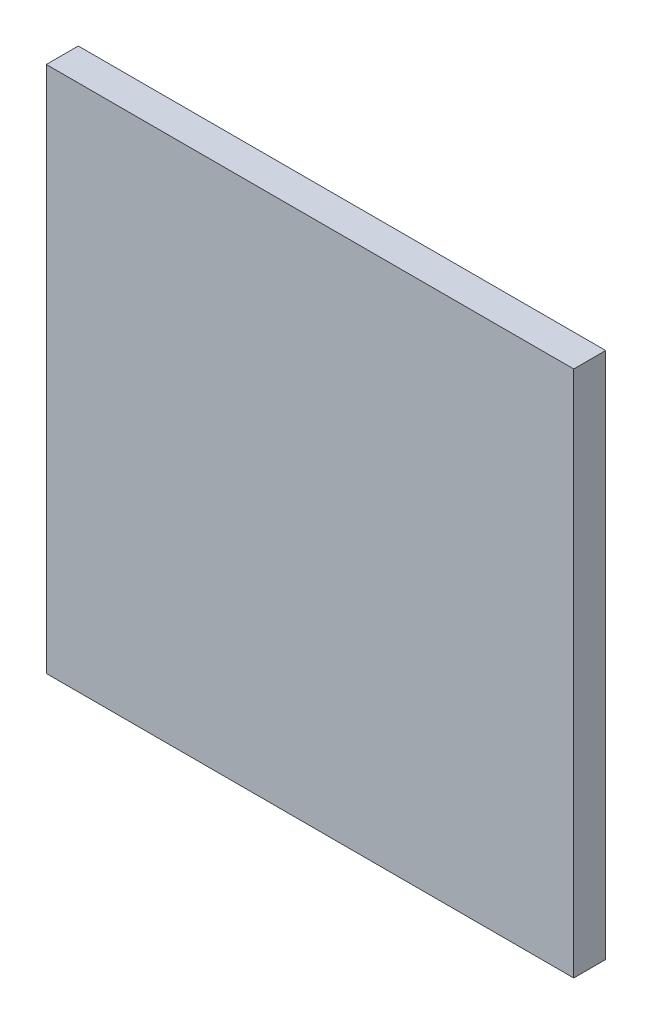
from build123d import *

# Parameters (mm, degrees)
SKETCH1_W           = 12.573
SKETCH1_H           = 12.573
BOSS_EXTRUDE1_DEPTH = 0.762
WRAP1_START         = -0.0508
WRAP1_DEPTH         = 0.0508


# Read off the part's stored shape, not the designer's step: Wrap1
with BuildPart() as part:
    # Sketch1 → Boss-Extrude1 (new body)
    with BuildSketch(Plane.XY):
        with Locations((-12.7, -106.3625)):
            Rectangle(SKETCH1_W, SKETCH1_H)
    extrude(amount=BOSS_EXTRUDE1_DEPTH)

    # Wrap1 outline → Wrap1 (cut)
    # profile 1 of 2: a face of its own
    with BuildSketch(Plane(origin=(0, 0, 0), x_dir=(-1, 0, 0), z_dir=(0, 0, -1)).offset(WRAP1_START)):
        with BuildLine():
            Line((13.893576609, -109.076767293), (13.848224931, -109.087871077))
            add(Edge.make_bspline(
                [(13.848224931, -109.087871077), (13.823281991, -109.09540343), (13.773440418, -109.110454755), (13.70247959, -109.142255202), (13.63418203, -109.178808447), (13.571127797, -109.224257623), (13.509613485, -109.27407518), (13.452633122, -109.331739179), (13.398630626, -109.395561914), (13.349044924, -109.465693939), (13.304301325, -109.541181248), (13.263834186, -109.619593938), (13.229962577, -109.701764726), (13.202140797, -109.787168697), (13.180033856, -109.876080706), (13.163381471, -109.968194926), (13.15384465, -110.063754119), (13.151261206, -110.128511062), (13.149950221, -110.161372385)],
                knots=[0, 0, 0, 0, 0.056876983, 0.113652934, 0.169591192, 0.22583551, 0.283188072, 0.342390943, 0.402653605, 0.465709187, 0.529811079, 0.594269064, 0.658351425, 0.723786874, 0.790362914, 0.858402864, 0.928145633, 1, 1, 1, 1], degree=3))
            add(Edge.make_bspline(
                [(13.149950221, -110.161372385), (13.151133652, -110.201387824), (13.153443848, -110.279502699), (13.169135154, -110.393288149), (13.190657418, -110.501386673), (13.221505103, -110.603374991), (13.258578554, -110.700191288), (13.306242747, -110.789812822), (13.360129711, -110.874231476), (13.422819758, -110.951148025), (13.491440908, -111.021209526), (13.566450448, -111.081782827), (13.645871161, -111.134442237), (13.730898183, -111.17697951), (13.82074451, -111.2111604), (13.916240063, -111.23441958), (14.016207988, -111.250588804), (14.084819235, -111.253546075), (14.119642212, -111.25504701)],
                knots=[0, 0, 0, 0, 0.07336391, 0.143215036, 0.210348057, 0.275297226, 0.338397068, 0.400134774, 0.461112918, 0.521784575, 0.581765109, 0.640634954, 0.698267936, 0.756179992, 0.81463112, 0.87415844, 0.936130329, 1, 1, 1, 1], degree=3))
            Line((14.119642212, -111.25504701), (14.86879804, -111.255046208))
            add(Edge.make_bspline(
                [(14.86879804, -111.255046208), (14.896966079, -111.253958886), (14.949201899, -111.251942518), (15.021159743, -111.237133618), (15.081127159, -111.214384084), (15.128076926, -111.179072565), (15.162401491, -111.132645731), (15.183093105, -111.074288901), (15.194773105, -111.005076775), (15.192949725, -110.955128247), (15.191968834, -110.928258345)],
                knots=[0, 0, 0, 0, 0.156430718, 0.290090734, 0.406759706, 0.509900415, 0.612128406, 0.722875106, 0.850920154, 1, 1, 1, 1], degree=3))
            Line((15.191968834, -110.928258345), (15.192294378, -107.807010932))
            add(Edge.make_bspline(
                [(15.192294378, -107.807010932), (15.192220374, -107.787963025), (15.192085749, -107.753311991), (15.191438705, -107.706340914), (15.189896895, -107.669622602), (15.187219904, -107.634430875), (15.177822601, -107.597311624), (15.161036391, -107.573746143), (15.152557136, -107.561842458)],
                knots=[0, 0, 0, 0, 0.225436693, 0.410103567, 0.55601467, 0.660125877, 0.828318623, 1, 1, 1, 1], degree=3))
            add(Edge.make_bspline(
                [(15.152557136, -107.561842458), (15.140824795, -107.549102492), (15.117230503, -107.523481817), (15.070603517, -107.49740351), (15.017309479, -107.481291692), (14.979436548, -107.47919208), (14.95960403, -107.478092599)],
                knots=[0, 0, 0, 0, 0.237755925, 0.478138407, 0.726722237, 1, 1, 1, 1], degree=3))
            add(Edge.make_bspline(
                [(14.95960403, -107.478092599), (14.940084055, -107.478357266), (14.903253541, -107.478856642), (14.85252232, -107.492093321), (14.810185229, -107.513828723), (14.776401924, -107.545676609), (14.752196068, -107.589176996), (14.736587199, -107.644114916), (14.726944693, -107.710663599), (14.726602158, -107.759136062), (14.726418149, -107.785175414)],
                knots=[0, 0, 0, 0, 0.130208102, 0.245678144, 0.347245765, 0.445678704, 0.551513815, 0.676036191, 0.825967013, 1, 1, 1, 1], degree=3))
            Line((14.726418149, -107.785175414), (14.726913682, -109.054559725))
            Line((14.726913682, -109.054559725), (14.415120899, -109.054559725))
            Line((14.415120899, -109.054559725), (13.576099632, -107.610337321))
            add(Edge.make_bspline(
                [(13.576099632, -107.610337321), (13.564208292, -107.591516547), (13.542627633, -107.557360201), (13.497448447, -107.518513669), (13.440591907, -107.499804868), (13.399966188, -107.498515186), (13.377388563, -107.497798448)],
                knots=[0, 0, 0, 0, 0.274636977, 0.498417098, 0.721246763, 1, 1, 1, 1], degree=3))
            add(Edge.make_bspline(
                [(13.377388563, -107.497798448), (13.360611811, -107.498540798), (13.32854378, -107.499959769), (13.282703643, -107.512137598), (13.241734712, -107.530784726), (13.205351857, -107.556424399), (13.176798041, -107.589734739), (13.15449874, -107.628489834), (13.141355897, -107.673794826), (13.139448942, -107.705993428), (13.138455142, -107.722773559)],
                knots=[0, 0, 0, 0, 0.136422267, 0.260765218, 0.38343879, 0.501594451, 0.620065055, 0.737841673, 0.86337758, 1, 1, 1, 1], degree=3))
            add(Edge.make_bspline(
                [(13.138455142, -107.722773559), (13.138374055, -107.735426661), (13.13822547, -107.75861247), (13.146111976, -107.787377308), (13.157344052, -107.810687106), (13.172271313, -107.833367722), (13.189422605, -107.864094381), (13.204212006, -107.885745963), (13.212352077, -107.89766297)],
                knots=[0, 0, 0, 0, 0.194991314, 0.357306156, 0.455808365, 0.594530958, 0.776830276, 1, 1, 1, 1], degree=3))
            Line((13.212352077, -107.89766297), (13.229901797, -107.925015099))
            Line((13.229901797, -107.925015099), (13.893576609, -109.076767293))
        make_face()
        with BuildLine():
            Line((14.726913682, -110.788673644), (14.103328117, -110.788673644))
            add(Edge.make_bspline(
                [(14.103328117, -110.788673644), (14.076993426, -110.78843001), (14.029903049, -110.787994357), (13.9651229, -110.77974118), (13.910491459, -110.761134075), (13.880319455, -110.740687073), (13.865108328, -110.730378777)],
                knots=[0, 0, 0, 0, 0.315692991, 0.564506423, 0.780447189, 1, 1, 1, 1], degree=3))
            add(Edge.make_bspline(
                [(13.865108328, -110.730378777), (13.846187402, -110.715953887), (13.807779881, -110.686672853), (13.760260425, -110.630238465), (13.716355076, -110.567373174), (13.68102564, -110.495143141), (13.652722065, -110.416560006), (13.630889006, -110.33340498), (13.618846348, -110.245741907), (13.616629954, -110.186038326), (13.615500906, -110.155624845)],
                knots=[0, 0, 0, 0, 0.109569805, 0.222415359, 0.338815424, 0.463178934, 0.59233843, 0.724167096, 0.859488517, 1, 1, 1, 1], degree=3))
            add(Edge.make_bspline(
                [(13.615500906, -110.155624845), (13.616273662, -110.130703759), (13.617797783, -110.081551455), (13.625634358, -110.008889097), (13.640962192, -109.939057961), (13.660278206, -109.871573988), (13.685521446, -109.807594892), (13.716877609, -109.748122783), (13.753774686, -109.693526063), (13.782632996, -109.661041177), (13.796958933, -109.644914923)],
                knots=[0, 0, 0, 0, 0.134754566, 0.265778832, 0.394315683, 0.520714897, 0.64488683, 0.765327786, 0.88350325, 1, 1, 1, 1], degree=3))
            add(Edge.make_bspline(
                [(13.796958933, -109.644914923), (13.816986427, -109.623907756), (13.855542702, -109.583465447), (13.918412787, -109.55093397), (13.973057484, -109.53408084), (14.021447942, -109.526736786), (14.076835025, -109.521676925), (14.1160689, -109.521190413), (14.13688483, -109.520932289)],
                knots=[0, 0, 0, 0, 0.230508939, 0.443768267, 0.555820232, 0.686670397, 0.833759807, 1, 1, 1, 1], degree=3))
            Line((14.13688483, -109.520932289), (14.726913682, -109.520932289))
            Line((14.726913682, -109.520932289), (14.726913682, -110.788673644))
        make_face(mode=Mode.SUBTRACT)
    # profile 2 of 2: a face of its own
    with BuildSketch(Plane(origin=(0, 0, 0), x_dir=(-1, 0, 0), z_dir=(0, 0, -1)).offset(WRAP1_START)):
        with BuildLine():
            add(Edge.make_bspline(
                [(11.459303672, -111.307595139), (11.490608218, -111.305905009), (11.554000764, -111.302482451), (11.649407023, -111.282687102), (11.745361023, -111.251282839), (11.841091734, -111.20860411), (11.933729137, -111.155709129), (12.02069549, -111.094234067), (12.101016799, -111.024773351), (12.147706132, -110.972057259), (12.171226383, -110.945500963)],
                knots=[0, 0, 0, 0, 0.114313593, 0.231488101, 0.354396382, 0.48231915, 0.613432772, 0.743168709, 0.870618491, 1, 1, 1, 1], degree=3))
            add(Edge.make_bspline(
                [(12.171226383, -110.945500963), (12.202933589, -110.902118194), (12.267555303, -110.813700786), (12.346773338, -110.664605081), (12.414240654, -110.500383238), (12.46836781, -110.320030236), (12.512142189, -110.124446367), (12.542574929, -109.913088883), (12.561717251, -109.686047872), (12.564109359, -109.529457185), (12.565343364, -109.448677509)],
                knots=[0, 0, 0, 0, 0.102218537, 0.208329207, 0.320506384, 0.439869332, 0.566442547, 0.701844883, 0.846192171, 1, 1, 1, 1], degree=3))
            add(Edge.make_bspline(
                [(12.565343364, -109.448677509), (12.564088407, -109.356412512), (12.561668764, -109.178519439), (12.543103334, -108.921845268), (12.511131194, -108.685540943), (12.474735535, -108.501738187), (12.439445087, -108.365513401), (12.409557944, -108.271347518), (12.377240987, -108.182869643), (12.340747627, -108.100608605), (12.302355232, -108.023849766), (12.260683819, -107.953124952), (12.215185907, -107.888677306), (12.182421707, -107.849024791), (12.16629992, -107.829513575)],
                knots=[0, 0, 0, 0, 0.16284409, 0.313974276, 0.453892687, 0.583497059, 0.644426551, 0.70217845, 0.757814594, 0.810592138, 0.86092999, 0.909230822, 0.955336575, 1, 1, 1, 1], degree=3))
            add(Edge.make_bspline(
                [(12.16629992, -107.829513575), (12.140740357, -107.803327268), (12.090326439, -107.751677155), (12.007403278, -107.682593036), (11.918427957, -107.624013053), (11.826110086, -107.573012223), (11.731389472, -107.531723087), (11.635988295, -107.502637266), (11.541505932, -107.482008089), (11.478342115, -107.47939013), (11.447036428, -107.478092599)],
                knots=[0, 0, 0, 0, 0.133558737, 0.263432488, 0.393148502, 0.521956684, 0.648192162, 0.769571529, 0.885793452, 1, 1, 1, 1], degree=3))
            add(Edge.make_bspline(
                [(11.447036428, -107.478092599), (11.418211397, -107.479230037), (11.360108082, -107.481522798), (11.273372281, -107.49943772), (11.185858582, -107.524333713), (11.099383274, -107.560741773), (11.015780994, -107.605611366), (10.936149158, -107.657118767), (10.863365261, -107.717732998), (10.819601218, -107.763134993), (10.797564485, -107.785996491)],
                knots=[0, 0, 0, 0, 0.117026589, 0.235893339, 0.358710427, 0.486342007, 0.616192598, 0.743887146, 0.871038185, 1, 1, 1, 1], degree=3))
            add(Edge.make_bspline(
                [(10.797564485, -107.785996491), (10.761631106, -107.830592845), (10.68839854, -107.921480636), (10.598567666, -108.076791002), (10.523989397, -108.248634602), (10.474980129, -108.403385463), (10.442568507, -108.535421626), (10.421495534, -108.64120538), (10.403059139, -108.752316912), (10.389817622, -108.868862019), (10.378057347, -108.990363062), (10.369692169, -109.117130019), (10.366046608, -109.249133497), (10.365258211, -109.338925458), (10.364856882, -109.384633499)],
                knots=[0, 0, 0, 0, 0.101436435, 0.206728416, 0.316913062, 0.433099217, 0.494072046, 0.557937225, 0.624319648, 0.693727134, 0.765875076, 0.840771696, 0.918945819, 1, 1, 1, 1], degree=3))
            add(Edge.make_bspline(
                [(10.364856882, -109.384633499), (10.365180261, -109.433901009), (10.365812816, -109.530272089), (10.370521312, -109.671853806), (10.379800907, -109.80735454), (10.391688998, -109.936945628), (10.408113977, -110.060483919), (10.428626983, -110.177673586), (10.452482071, -110.288868221), (10.479295461, -110.394228131), (10.510573284, -110.493995921), (10.545942172, -110.588149148), (10.584213605, -110.677697349), (10.62826416, -110.761080806), (10.67440413, -110.840618534), (10.726840421, -110.913366993), (10.781496743, -110.982310532), (10.821846584, -111.024086408), (10.841902646, -111.044851286)],
                knots=[0, 0, 0, 0, 0.083413307, 0.163162916, 0.239790112, 0.313333137, 0.383455053, 0.450723208, 0.514706389, 0.575958318, 0.634727082, 0.691618963, 0.746197416, 0.79946178, 0.851196508, 0.901723909, 0.951151449, 1, 1, 1, 1], degree=3))
            add(Edge.make_bspline(
                [(10.841902646, -111.044851286), (10.864266756, -111.064720642), (10.90879065, -111.10427782), (10.981516318, -111.155572583), (11.057132704, -111.201459322), (11.136654337, -111.238609698), (11.217190841, -111.269283259), (11.298158713, -111.290478729), (11.378414143, -111.30439263), (11.431928401, -111.306532276), (11.458531507, -111.30759594)],
                knots=[0, 0, 0, 0, 0.130875677, 0.260555615, 0.388989564, 0.517624575, 0.644262944, 0.765751474, 0.883549944, 1, 1, 1, 1], degree=3))
            Line((11.458531507, -111.30759594), (11.459303672, -111.307595139))
        make_face()
        with BuildLine():
            add(Edge.make_bspline(
                [(11.043887599, -110.534141363), (11.026835983, -110.500212437), (10.991648345, -110.430196859), (10.949501455, -110.315852315), (10.913765843, -110.19057973), (10.883147322, -110.054422258), (10.861002171, -109.906724606), (10.843376793, -109.748457093), (10.834069546, -109.578789967), (10.832195691, -109.462097827), (10.831228644, -109.401876117)],
                knots=[0, 0, 0, 0, 0.097908466, 0.202043468, 0.313782327, 0.433877003, 0.561812021, 0.698900242, 0.844610423, 1, 1, 1, 1], degree=3))
            add(Edge.make_bspline(
                [(10.831228644, -109.401876117), (10.831720405, -109.337265299), (10.832671322, -109.21232766), (10.843853092, -109.031568701), (10.860093378, -108.863397351), (10.885870445, -108.708639055), (10.916868737, -108.566371035), (10.957858165, -108.438027259), (11.003002451, -108.321323811), (11.042274006, -108.251438435), (11.061130217, -108.217883017)],
                knots=[0, 0, 0, 0, 0.158896388, 0.307257211, 0.445314327, 0.57424794, 0.692976378, 0.803053227, 0.905436137, 1, 1, 1, 1], degree=3))
            add(Edge.make_bspline(
                [(11.061130217, -108.217883017), (11.073510839, -108.19837185), (11.09807547, -108.159659367), (11.143061225, -108.108313942), (11.191640525, -108.06169102), (11.244600523, -108.021773765), (11.29990534, -107.989427076), (11.354852999, -107.964038051), (11.409818261, -107.948537301), (11.446402062, -107.945801321), (11.464279046, -107.944464361)],
                knots=[0, 0, 0, 0, 0.136847161, 0.271521084, 0.403547886, 0.535664444, 0.663710536, 0.782858226, 0.893891837, 1, 1, 1, 1], degree=3))
            add(Edge.make_bspline(
                [(11.464279046, -107.944464361), (11.481059159, -107.945547821), (11.514505103, -107.947707361), (11.56375097, -107.961096401), (11.612094025, -107.979733329), (11.659478681, -108.005422937), (11.704671607, -108.038957622), (11.749098651, -108.078603515), (11.792793412, -108.124744821), (11.8198046, -108.15908335), (11.833763717, -108.176829165)],
                knots=[0, 0, 0, 0, 0.111403148, 0.222047582, 0.33714062, 0.455068886, 0.578672945, 0.709987273, 0.850124266, 1, 1, 1, 1], degree=3))
            add(Edge.make_bspline(
                [(11.833763717, -108.176829165), (11.854855494, -108.208642311), (11.899183781, -108.275503544), (11.951705772, -108.391335366), (11.996242083, -108.52411499), (12.033747445, -108.67375277), (12.062557483, -108.839267458), (12.083943963, -109.019603846), (12.09573294, -109.21451496), (12.097866639, -109.349312247), (12.098971603, -109.419118735)],
                knots=[0, 0, 0, 0, 0.088780597, 0.186588909, 0.295034394, 0.414690577, 0.545475669, 0.686048239, 0.83741609, 1, 1, 1, 1], degree=3))
            add(Edge.make_bspline(
                [(12.098971603, -109.419118735), (12.098147301, -109.481810855), (12.096544047, -109.603746112), (12.085195962, -109.781354948), (12.065578946, -109.948257821), (12.038711922, -110.103665278), (12.005867973, -110.246273266), (11.965474317, -110.374131446), (11.920243697, -110.487554997), (11.881076155, -110.554243152), (11.862501413, -110.585869217)],
                knots=[0, 0, 0, 0, 0.15621051, 0.303827159, 0.443233162, 0.574749141, 0.696663336, 0.807526428, 0.908721697, 1, 1, 1, 1], degree=3))
            add(Edge.make_bspline(
                [(11.862501413, -110.585869217), (11.849758426, -110.603435333), (11.824382624, -110.638415692), (11.778912275, -110.685498128), (11.729215273, -110.729066032), (11.674772442, -110.766960007), (11.619370776, -110.798620244), (11.564463889, -110.822411599), (11.511080497, -110.836801952), (11.475804367, -110.839777365), (11.458876832, -110.841195254)],
                knots=[0, 0, 0, 0, 0.13180551, 0.26247147, 0.396949864, 0.533147162, 0.665047191, 0.784357365, 0.896166349, 0.999298693, 0.999298693, 0.999298693, 0.999298693], degree=3))
            add(Edge.make_bspline(
                [(11.458876832, -110.841195254), (11.440309217, -110.840006754), (11.402330161, -110.837542408), (11.345848317, -110.820020674), (11.289710997, -110.79239799), (11.234385741, -110.755199494), (11.180555478, -110.710758794), (11.131017465, -110.657718285), (11.084101869, -110.59942647), (11.057397744, -110.556074157), (11.043887599, -110.534141363)],
                knots=[0.00079286, 0.00079286, 0.00079286, 0.00079286, 0.104261604, 0.212462094, 0.327843685, 0.452318812, 0.583466916, 0.716274741, 0.856457777, 1, 1, 1, 1], degree=3))
        make_face(mode=Mode.SUBTRACT)
    extrude(amount=WRAP1_DEPTH, mode=Mode.SUBTRACT)


solid = part.part
